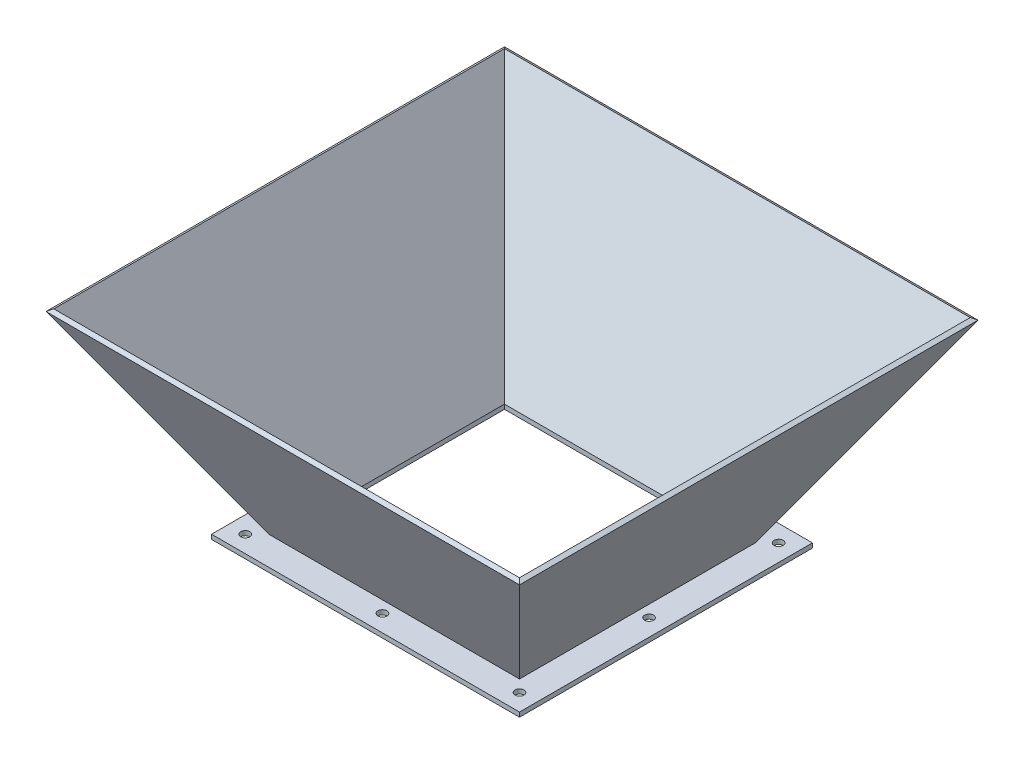
from build123d import *

# Parameters (mm, degrees)
BOSS_EXTRUDE1_DEPTH   = 200
BOSS_EXTRUDE2_START   = -155
BOSS_EXTRUDE2_DEPTH   = 310
BOSS_EXTRUDE2_START_2 = 75
BOSS_EXTRUDE2_2_DEPTH = 77.598076211
CUT_EXTRUDE1_DEPTH    = 286.853377845
SKETCH4_W             = 315.196152422
SKETCH4_H             = 3
CUT_EXTRUDE2_DEPTH    = 373.124552005
SKETCH5_W             = 205
SKETCH5_H             = 22.5
BOSS_EXTRUDE3_DEPTH   = 3
SKETCH6_R             = 3
CUT_EXTRUDE3_DEPTH    = 255.947693633


with BuildPart() as part:
    # Sketch1 → Boss-Extrude1 (new, symmetric)
    with BuildSketch(Plane.XY):
        Polygon((-102.5, 0), (-102.5, -3), (-80, -3), (-80, 0), (-155, 129.903810568), (-157.598076211, 128.403810568), (-83.464101615, 0), align=None)
    extrude(amount=BOSS_EXTRUDE1_DEPTH, both=True)


with BuildPart() as body_2:
    # Mirror3: mirrored copy
    add(part.part.mirror(Plane(origin=(0, 0, 0), x_dir=(0, 0, 1), z_dir=(1, 0, 0))))


with BuildPart() as body_3:
    # Boss-Extrude2: read off the stored shape, not the designer's step
    # Boss-Extrude2 outline → Boss-Extrude2 (new body)
    with BuildSketch(Plane(origin=(0, 0, 0), x_dir=(0, 0, -1), z_dir=(1, 0, 0)).offset(BOSS_EXTRUDE2_START)):
        Polygon((-150, 129.903810568), (-152.598076211, 128.403810568), (-78.464101615, 0), (-97.5, 0), (-97.5, -3), (-75, -3), (-75, 0), align=None)
    extrude(amount=BOSS_EXTRUDE2_DEPTH)

    # Boss-Extrude2 2 outline → Boss-Extrude2 2 (cut)
    with BuildSketch(Plane.XY.offset(BOSS_EXTRUDE2_START_2)):
        Polygon((155, 129.903810568), (78.267949192, -3), (155, -3), align=None)
        Polygon((-155, 129.903810568), (-155, -3), (-78.267949192, -3), align=None)
    extrude(amount=BOSS_EXTRUDE2_2_DEPTH, mode=Mode.SUBTRACT)


with BuildPart() as body_4:
    # Mirror5: mirrored copy
    add(body_3.part.mirror(Plane.XY))


with BuildPart() as cut_extrude1_tool:
    # Sketch3 → Cut-Extrude1 (new, symmetric)
    with BuildSketch(Plane(origin=(0, 0, 0), x_dir=(0, 0, -1), z_dir=(1, 0, 0))):
        Polygon((-152.598076211, 128.403810568), (-78.464101615, 0), (-97.5, 0), (-97.5, -3), (-200, -3), (-200, 129.903810568), (-153.464101615, 129.903810568), align=None)
    cut_extrude1 = extrude(amount=CUT_EXTRUDE1_DEPTH, both=True)


with BuildPart() as part_1:
    add(part.part)

    # Cut-Extrude1: cut by cut_extrude1_tool
    add(cut_extrude1_tool.part, mode=Mode.SUBTRACT)


with BuildPart() as body_2_1:
    add(body_2.part)

    # Cut-Extrude1: cut by cut_extrude1_tool
    add(cut_extrude1_tool.part, mode=Mode.SUBTRACT)


with BuildPart() as cut_extrude2_tool:
    # Sketch4 → Cut-Extrude2 (new, through all)
    with BuildSketch(Plane(origin=(0, 162.37976321, 93.75), x_dir=(1, 0, 0), z_dir=(0, 0.8660254037844436, 0.4999999999999916))):
        with Locations((0, -66.451905284)):
            Rectangle(SKETCH4_W, SKETCH4_H)
    cut_extrude2 = extrude(amount=CUT_EXTRUDE2_DEPTH)


with BuildPart() as part_2:
    add(part_1.part)

    # Cut-Extrude2: cut by cut_extrude2_tool
    add(cut_extrude2_tool.part, mode=Mode.SUBTRACT)



with BuildPart() as body_2_2:
    add(body_2_1.part)

    # Cut-Extrude2: cut by cut_extrude2_tool
    add(cut_extrude2_tool.part, mode=Mode.SUBTRACT)


with BuildPart() as part_3:
    add(part_2.part)

    add(body_2_2.part)  # Boss-Extrude3 merges body 2

    add(body_3.part)  # Boss-Extrude3 merges body 3
    # Sketch5 → Boss-Extrude3 (add)
    with BuildSketch(Plane.XZ.offset(3)):
        with Locations((0, 86.25)):
            Rectangle(SKETCH5_W, SKETCH5_H)
    boss_extrude3 = extrude(amount=-BOSS_EXTRUDE3_DEPTH)

    # Mirror9: Cut-Extrude1, Cut-Extrude2 across plane
    add(cut_extrude1.mirror(Plane.XY), mode=Mode.SUBTRACT)
    add(cut_extrude2.mirror(Plane.XY), mode=Mode.SUBTRACT)

    # Mirror9 2: Boss-Extrude3 across plane
    add(boss_extrude3.mirror(Plane.XY))

    # Combine5: union body 4
    add(body_4.part)

    # Sketch6 → Cut-Extrude3 (cut, through all)
    with BuildSketch(Plane(origin=(0, 0, 0), x_dir=(1, 0, 0), z_dir=(0, 1, 0))):
        with Locations(Location((-91.25, 86.25, 0), (0, 0, 270))):
            Circle(SKETCH6_R)
        with Locations(Location((0, 86.25, 0), (0, 0, 270))):
            Circle(SKETCH6_R)
        with Locations(Location((91.25, 86.25, 0), (0, 0, 270))):
            Circle(SKETCH6_R)
        with Locations(Location((-91.25, 0, 0), (0, 0, 270))):
            Circle(SKETCH6_R)
        with Locations(Location((91.25, 0, 0), (0, 0, 270))):
            Circle(SKETCH6_R)
        with Locations(Location((91.25, -86.25, 0), (0, 0, 270))):
            Circle(SKETCH6_R)
        with Locations(Location((0, -86.25, 0), (0, 0, 270))):
            Circle(SKETCH6_R)
        with Locations(Location((-91.25, -86.25, 0), (0, 0, 270))):
            Circle(SKETCH6_R)
    extrude(amount=-CUT_EXTRUDE3_DEPTH, mode=Mode.SUBTRACT)


solid = part_3.part
